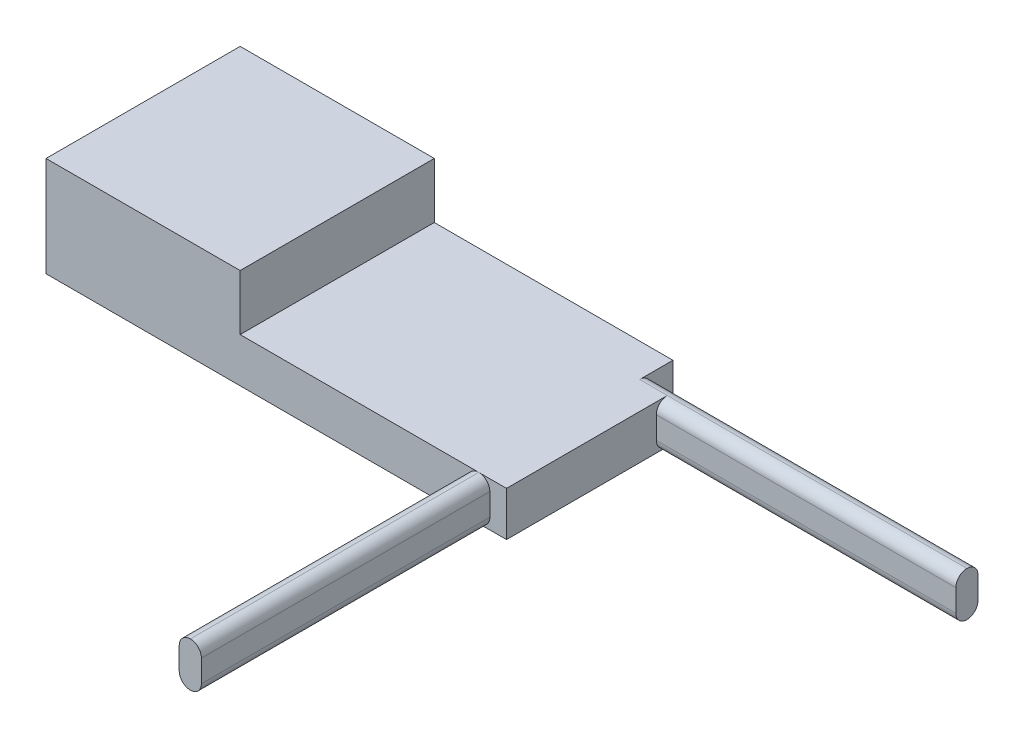
from build123d import *

# Parameters (mm, degrees)
BOSS_EXTRUDE1_DEPTH = 4
FILLET1_R           = 1
SKETCH4_W           = 17.5
SKETCH4_H           = 17.5
BOSS_EXTRUDE3_DEPTH = 5


with BuildPart() as part:
    # Sketch2 → Boss-Extrude1 (new body)
    with BuildSketch(Plane(origin=(0, 0, 0), x_dir=(1, 0, 0), z_dir=(0, 1, 0))):
        Polygon((0, 0), (26.5, 0), (26.5, -26), (28.5, -26), (28.5, 0), (30, 0), (30, 13.5), (57, 13.5), (57, 15.5), (29, 15.5), (27.5, 15.5), (27.5, 17.5), (2.991015417, 17.5), (-11.508984583, 17.5), (-11.508984583, 0), align=None)
    extrude(amount=BOSS_EXTRUDE1_DEPTH)

    # Fillet1
    fillet1_edges = [part.edges().sort_by_distance(p)[0] for p in [
        (42.25, 0, -15.5),
        (28.5, 0, 13),
        (26.5, 0, 13),
        (43.5, 0, -13.5),
        (42.25, 4, -15.5),
        (43.5, 4, -13.5),
        (28.5, 4, 13),
        (26.5, 4, 13),
    ]]
    fillet(fillet1_edges, radius=FILLET1_R - 0.0001)  # a hair under: the kernel refuses the full size

    # Sketch4 → Boss-Extrude3 (add)
    with BuildSketch(Plane(origin=(0, 4, 0), x_dir=(1, 0, 0), z_dir=(0, 1, 0))):
        with Locations((-2.758984583, 8.75)):
            Rectangle(SKETCH4_W, SKETCH4_H)
    extrude(amount=BOSS_EXTRUDE3_DEPTH)


solid = part.part
